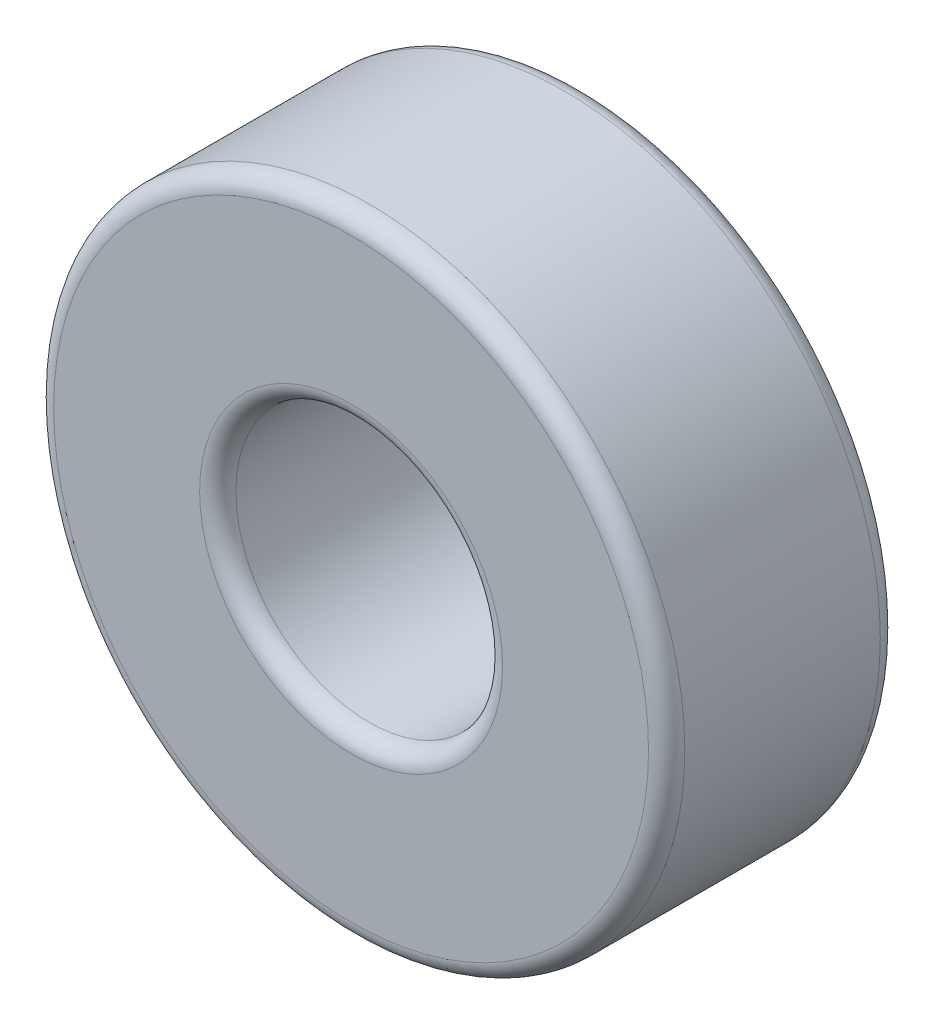
from build123d import *

# Parameters (mm, degrees)
SKETCH1_R          = 22.6
SKETCH1_R_2        = 9.55
MAIN_EXTRUDE_DEPTH = 8.3
FILLETS_R          = 1.3


with BuildPart() as part:
    # Sketch1 → Main Extrude (new, symmetric)
    with BuildSketch(Plane.XY):
        Circle(SKETCH1_R)
        Circle(SKETCH1_R_2, mode=Mode.SUBTRACT)
    extrude(amount=MAIN_EXTRUDE_DEPTH, both=True)

    # Fillets
    fillets_edges = [part.edges().sort_by_distance(p)[0] for p in [
        (-9.55, 0, -8.3),
        (-9.55, 0, 8.3),
        (-22.6, 0, 8.3),
        (-22.6, 0, -8.3),
    ]]
    fillet(fillets_edges, radius=FILLETS_R)


solid = part.part
